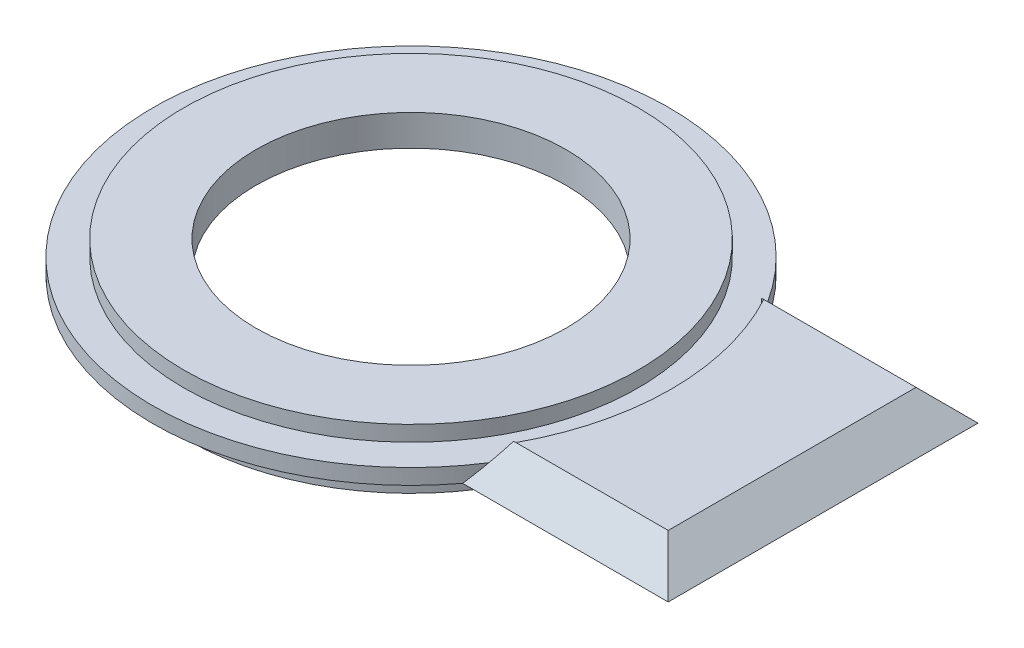
from build123d import *

# Parameters (mm, degrees)
BOSS_EXTRUDE1_DEPTH    = 3
BOSS_EXTRUDE2_DEPTH    = 3
SKETCH3_R              = 15
CUT_EXTRUDE1_DEPTH     = 3
CHAMFER1_SIZE          = 3
CUT_EXTRUDE2_START     = -1.5
CUT_EXTRUDE2_OUTLINE_R = 22
CUT_EXTRUDE2_DEPTH     = 1.5


# Read off the part's stored shape, not the designer's step: Cut-Extrude2
with BuildPart() as part:
    # Sketch1 → Boss-Extrude1 (new body)
    with BuildSketch(Plane(origin=(0, 0, 0), x_dir=(1, 0, 0), z_dir=(0, 1, 0))):
        with BuildLine():
            Line((20, 15), (39.9, 15))
            Line((39.9, 15), (39.9, -15))
            Line((39.9, -15), (20, -15))
            ThreePointArc((20, -15), (-25, 0), (20, 15))
        make_face()
    extrude(amount=BOSS_EXTRUDE1_DEPTH)

    # Sketch2 → Boss-Extrude2 (add)
    with BuildSketch(Plane.XZ):
        with BuildLine():
            Line((18.275666882, -11.7), (36.6, -11.7))
            Line((36.6, -11.7), (36.6, 11.7))
            Line((36.6, 11.7), (18.275666882, 11.7))
            ThreePointArc((18.275666882, 11.7), (-21.7, 0), (18.275666882, -11.7))
        make_face()
        with BuildLine():
            Line((17.146428199, -9.7), (34.6, -9.7))
            Line((34.6, -9.7), (34.6, 9.7))
            Line((34.6, 9.7), (17.146428199, 9.7))
            ThreePointArc((17.146428199, 9.7), (-19.7, 0), (17.146428199, -9.7))
        make_face(mode=Mode.SUBTRACT)
    extrude(amount=BOSS_EXTRUDE2_DEPTH)

    # Sketch3 → Cut-Extrude1 (cut)
    with BuildSketch(Plane.XZ):
        with Locations(Location((0, 0, 0), (0, 0, 270))):
            Circle(SKETCH3_R)
    extrude(amount=-CUT_EXTRUDE1_DEPTH, mode=Mode.SUBTRACT)

    # Chamfer1
    chamfer1_edges = [part.edges().sort_by_distance(p)[0] for p in [
        (29.95, 3, 15),
        (39.9, 3, 0),
        (29.95, 3, -15),
    ]]
    chamfer(chamfer1_edges, length=CHAMFER1_SIZE - 0.0001)  # a hair under: the kernel refuses the full size

    # Cut-Extrude2 outline → Cut-Extrude2 (cut)
    with BuildSketch(Plane(origin=(0, 3, 0), x_dir=(1, 0, 0), z_dir=(0, 1, 0)).offset(CUT_EXTRUDE2_START)):
        with BuildLine():
            Line((22.159422375, 12), (21.931712199, 12))
            ThreePointArc((21.931712199, 12), (21.499754333, 12.757764836), (21.041625413, 13.5))
            ThreePointArc((21.041625413, 13.5), (-25, 0), (21.041625412, -13.5))
            ThreePointArc((21.041625412, -13.5), (21.499754333, -12.757764836), (21.931712199, -12))
            Line((21.931712199, -12), (22.159422375, -12))
            ThreePointArc((22.159422375, -12), (25.2, 0), (22.159422375, 12))
        make_face()
        Circle(CUT_EXTRUDE2_OUTLINE_R, mode=Mode.SUBTRACT)
    extrude(amount=CUT_EXTRUDE2_DEPTH, mode=Mode.SUBTRACT)


solid = part.part
